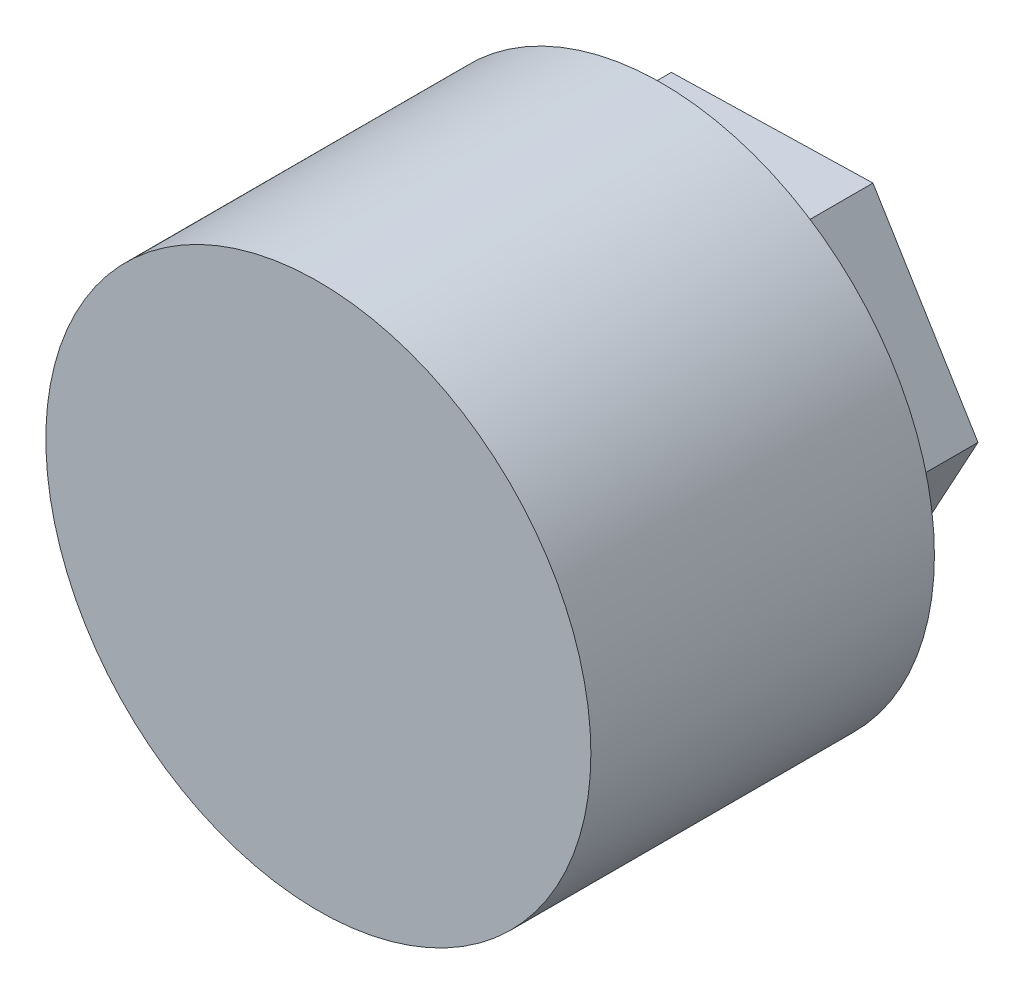
from build123d import *

# Parameters (mm, degrees)
SKETCH_1_R      = 23.797606223
EXTRUDE_1_DEPTH = 30
EXTRUDE_2_DEPTH = 10


with BuildPart() as part:
    # Эскиз1 → Бобышка-Вытянуть1 (new body)
    with BuildSketch(Plane.XY):
        Circle(SKETCH_1_R)
    extrude(amount=EXTRUDE_1_DEPTH)

    # Эскиз2 → Бобышка-Вытянуть2 (add)
    with BuildSketch(Plane(origin=(0, 0, 0), x_dir=(-1, 0, 0), z_dir=(0, 0, -1))):
        Polygon((8.428591824, -15.45917893), (17.602337587, -0.430214828), (9.173745764, 15.028964103), (-8.428591824, 15.45917893), (-17.602337587, 0.430214828), (-9.173745764, -15.028964103), align=None)
    extrude(amount=EXTRUDE_2_DEPTH)


solid = part.part
